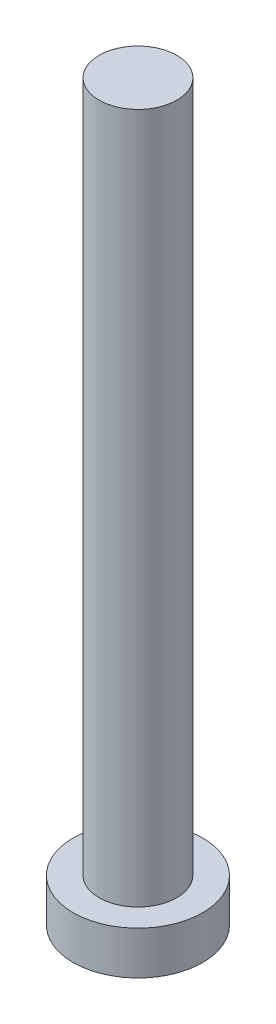
from build123d import *

# Parameters (mm, degrees)
SKETCH2_R           = 0.45
BOSS_EXTRUDE1_DEPTH = 8
SKETCH2_3_R         = 0.75
BOSS_EXTRUDE2_DEPTH = 0.5


with BuildPart() as part:
    # Sketch2 → Boss-Extrude1 (new body)
    with BuildSketch(Plane(origin=(0, 0, 0), x_dir=(1, 0, 0), z_dir=(0, 1, 0))):
        Circle(SKETCH2_R)
    extrude(amount=BOSS_EXTRUDE1_DEPTH)

    # Sketch2<3> → Boss-Extrude2 (add)
    with BuildSketch(Plane(origin=(0, 0, 0), x_dir=(1, 0, 0), z_dir=(0, 1, 0))):
        Circle(SKETCH2_3_R)
    extrude(amount=-BOSS_EXTRUDE2_DEPTH)


solid = part.part
